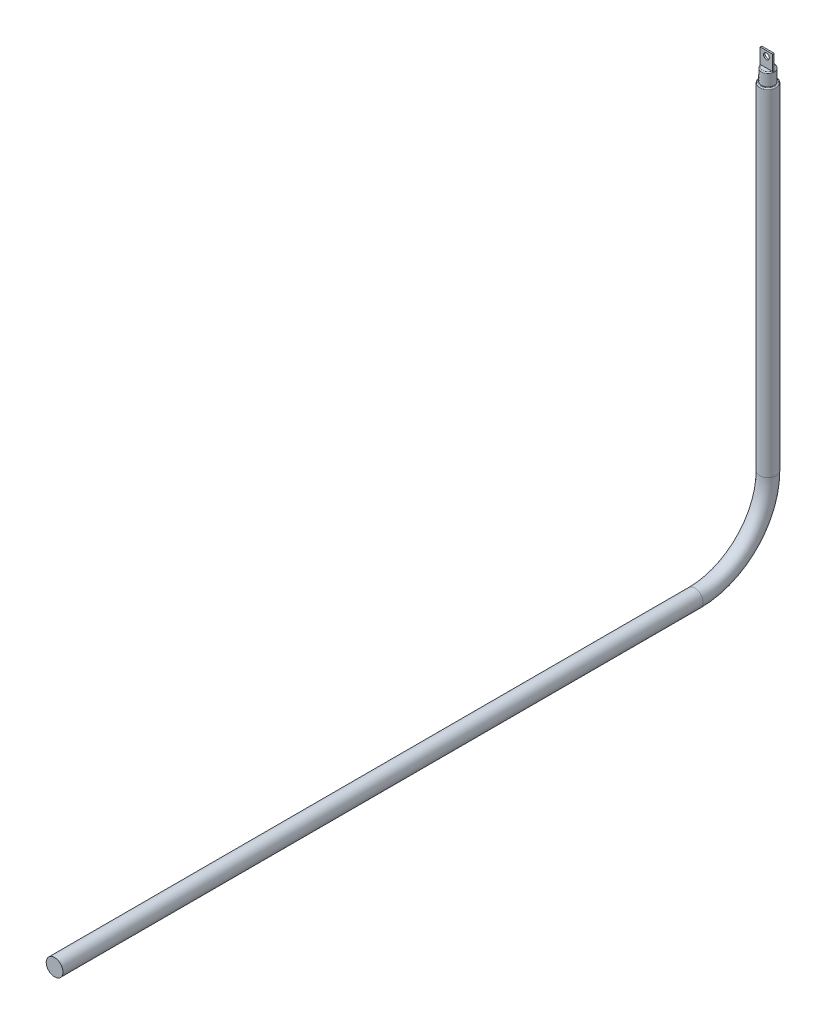
from build123d import *

# Parameters (mm, degrees)
BARRER1_PROFILE_R       = 16
CROQUIS22_W             = 24
CROQUIS22_H             = 30
CROQUIS22_R             = 5.5
SALIENTE_EXTRUIR1_DEPTH = 3
CROQUIS23_R             = 12.5
SALIENTE_EXTRUIR2_DEPTH = 24
SALIENTE_EXTRUIR2_TAPER = 0.1
REDONDEO1_R             = 2
REDONDEO2_R             = 2


with BuildPart() as part:
    # Barrer1: sweep along a curve in space
    with BuildLine() as barrer1_path:
        Line((1184.694036121, -317.266225222, 2234.993228397), (1184.694036121, -961.667575773, 2234.993228397))
        ThreePointArc((1184.694036121, -961.667575773, 2234.993228397), (1184.694036121, -1060.66252514, 2275.998279031), (1184.694036121, -1101.667575773, 2374.993228397))
        Line((1184.694036121, -1101.667575773, 2374.993228397), (1184.694036121, -1101.667575773, 3598.952990458))
    # Barrer1 profile (on start of the path) → Barrer1 (sweep)
    with BuildSketch(Plane(origin=(1184.694036121, -317.266225222, 2234.993228397), x_dir=(0, 0, -1), z_dir=(0, -1, 0))):
        Circle(BARRER1_PROFILE_R)
    sweep(path=barrer1_path.line)



with BuildPart() as body_2:
    # Croquis22 → Saliente-Extruir1 (new body)
    with BuildSketch(Plane.XY.offset(2234.993228397)):
        with Locations((1184.694036121, -279.321290843)):
            Rectangle(CROQUIS22_W, CROQUIS22_H)
        with Locations((1184.694036121, -273.810487485)):
            Circle(CROQUIS22_R, mode=Mode.SUBTRACT)
    extrude(amount=SALIENTE_EXTRUIR1_DEPTH)


with BuildPart() as part_1:
    add(part.part)

    add(body_2.part)  # Saliente-Extruir2 merges body 2
    # Croquis23 → Saliente-Extruir2 (add)
    with BuildSketch(Plane(origin=(0, -317.266225222, 0), x_dir=(1, 0, 0), z_dir=(0, 1, 0))):
        with Locations((1184.694036121, -2234.993228397)):
            Circle(CROQUIS23_R)
    extrude(amount=SALIENTE_EXTRUIR2_DEPTH, taper=SALIENTE_EXTRUIR2_TAPER)

    # Redondeo1
    # the kernel refuses this fillet: 2 mm, written as the material it takes off along each edge
    with BuildSketch(Plane(origin=(1184.694036121, -293.266225222, 2234.993228397), x_dir=(1, 0, 0), z_dir=(0, 0, -1))) as redondeo1_piece_1_section:
        with BuildLine():
            CenterArc((12.458112055 - REDONDEO1_R * 0.998256192065, REDONDEO1_R), REDONDEO1_R, 270, 89.9)
            Line((12.458112055 - REDONDEO1_R * 0.998256192065, 0), (12.458112055, 0))
            Line((12.458112055, 0), (12.458112055 + REDONDEO1_R * 0.00174228484855, REDONDEO1_R * 0.998254671634))
        make_face()
    redondeo1_piece_1 = revolve(axis=Axis((1184.694036121, -293.266225222, 2234.993228397), (0, -1, 0)), mode=Mode.PRIVATE)
    redondeo1_piece_1 = split(redondeo1_piece_1, bisect_by=Plane(origin=(1196.694036121, -293.909040816, 2236.28595065), z_dir=(1, 0, 0)), keep=Keep.TOP, mode=Mode.PRIVATE)
    add(redondeo1_piece_1, mode=Mode.SUBTRACT)
    with BuildSketch(Plane(origin=(1184.694036121, -293.266225222, 2234.993228397), x_dir=(1, 0, 0), z_dir=(0, 0, -1))) as redondeo1_piece_2_section:
        with BuildLine():
            CenterArc((12.458112055 - REDONDEO1_R * 0.998256192065, REDONDEO1_R), REDONDEO1_R, 270, 89.9)
            Line((12.458112055 - REDONDEO1_R * 0.998256192065, 0), (12.458112055, 0))
            Line((12.458112055, 0), (12.458112055 + REDONDEO1_R * 0.00174228484855, REDONDEO1_R * 0.998254671634))
        make_face()
    redondeo1_piece_2 = revolve(axis=Axis((1184.694036121, -293.266225222, 2234.993228397), (0, -1, 0)), mode=Mode.PRIVATE)
    redondeo1_piece_2 = split(redondeo1_piece_2, bisect_by=Plane(origin=(1184.694036121, -293.82884964, 2234.993228397), z_dir=(0, 0, -1)), keep=Keep.TOP, mode=Mode.PRIVATE)
    add(redondeo1_piece_2, mode=Mode.SUBTRACT)
    with BuildSketch(Plane(origin=(1184.694036121, -293.266225222, 2234.993228397), x_dir=(1, 0, 0), z_dir=(0, 0, -1))) as redondeo1_piece_3_section:
        with BuildLine():
            CenterArc((12.458112055 - REDONDEO1_R * 0.998256192065, REDONDEO1_R), REDONDEO1_R, 270, 89.9)
            Line((12.458112055 - REDONDEO1_R * 0.998256192065, 0), (12.458112055, 0))
            Line((12.458112055, 0), (12.458112055 + REDONDEO1_R * 0.00174228484855, REDONDEO1_R * 0.998254671634))
        make_face()
    redondeo1_piece_3 = revolve(axis=Axis((1184.694036121, -293.266225222, 2234.993228397), (0, -1, 0)), mode=Mode.PRIVATE)
    redondeo1_piece_3 = split(redondeo1_piece_3, bisect_by=Plane(origin=(1184.694036121, -293.82954, 2237.993228397), z_dir=(0, 0, 1)), keep=Keep.TOP, mode=Mode.PRIVATE)
    add(redondeo1_piece_3, mode=Mode.SUBTRACT)
    with BuildSketch(Plane(origin=(1184.694036121, -293.266225222, 2234.993228397), x_dir=(1, 0, 0), z_dir=(0, 0, -1))) as redondeo1_piece_4_section:
        with BuildLine():
            CenterArc((12.458112055 - REDONDEO1_R * 0.998256192065, REDONDEO1_R), REDONDEO1_R, 270, 89.9)
            Line((12.458112055 - REDONDEO1_R * 0.998256192065, 0), (12.458112055, 0))
            Line((12.458112055, 0), (12.458112055 + REDONDEO1_R * 0.00174228484855, REDONDEO1_R * 0.998254671634))
        make_face()
    redondeo1_piece_4 = revolve(axis=Axis((1184.694036121, -293.266225222, 2234.993228397), (0, -1, 0)), mode=Mode.PRIVATE)
    redondeo1_piece_4 = split(redondeo1_piece_4, bisect_by=Plane(origin=(1172.694036121, -293.908477317, 2236.286131644), z_dir=(-1, 0, 0)), keep=Keep.TOP, mode=Mode.PRIVATE)
    add(redondeo1_piece_4, mode=Mode.SUBTRACT)

    # Redondeo2
    redondeo2_edges = [part_1.edges().sort_by_distance(p)[0] for p in [
        (1184.694036121, -317.266225222, 2250.993228397),
    ]]
    fillet(redondeo2_edges, radius=REDONDEO2_R)


solid = part_1.part
